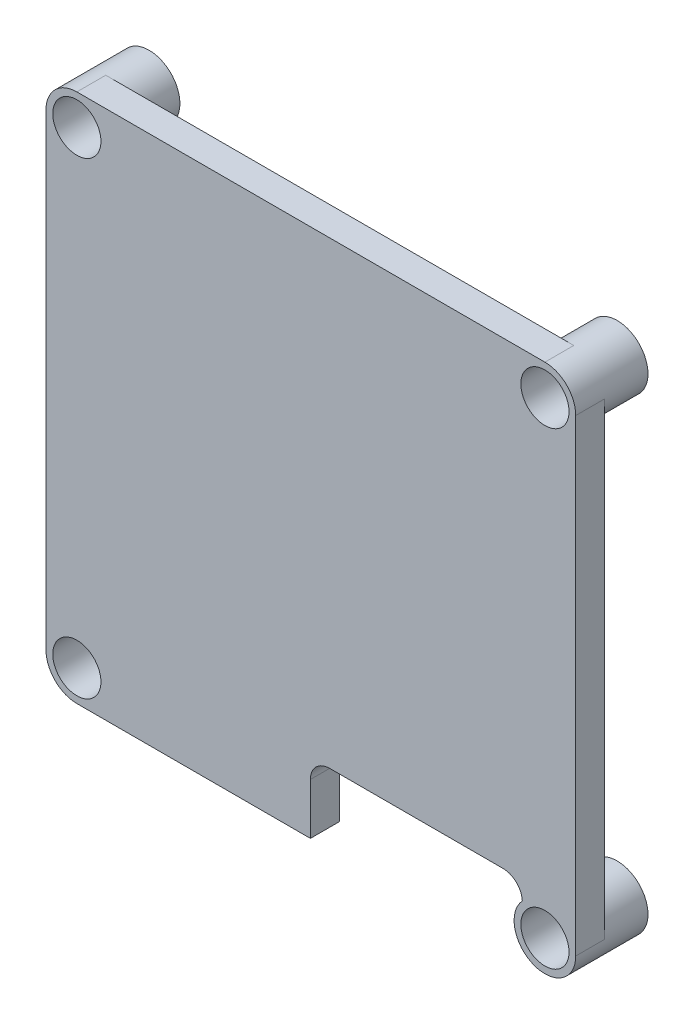
from build123d import *

# Parameters (mm, degrees)
SKETCH1_R             = 1.6
SKETCH1_R_2           = 1.25
BOSS_EXTRUDE1_DEPTH   = 2.25
BOSS_EXTRUDE1_2_DEPTH = 2.25
BOSS_EXTRUDE1_3_DEPTH = 2.25
BOSS_EXTRUDE1_4_DEPTH = 2.25
SKETCH2_R             = 1.25
BOSS_EXTRUDE2_DEPTH   = 1.5
FILLET1_R             = 1


with BuildPart() as part:
    # Sketch1 → Boss-Extrude1 (new body)
    with BuildSketch(Plane.XY):
        with Locations((-12.15, 12.15)):
            Circle(SKETCH1_R)
        with Locations((-12.15, 12.15)):
            Circle(SKETCH1_R_2, mode=Mode.SUBTRACT)
    extrude(amount=BOSS_EXTRUDE1_DEPTH)



with BuildPart() as body_2:
    # Sketch1 → Boss-Extrude1 2 (new body)
    with BuildSketch(Plane.XY):
        with Locations((12.15, 12.15)):
            Circle(SKETCH1_R)
        with Locations((12.15, 12.15)):
            Circle(SKETCH1_R_2, mode=Mode.SUBTRACT)
    extrude(amount=BOSS_EXTRUDE1_2_DEPTH)


with BuildPart() as body_3:
    # Sketch1 → Boss-Extrude1 3 (new body)
    with BuildSketch(Plane.XY):
        with Locations((12.15, -12.15)):
            Circle(SKETCH1_R)
        with Locations((12.15, -12.15)):
            Circle(SKETCH1_R_2, mode=Mode.SUBTRACT)
    extrude(amount=BOSS_EXTRUDE1_3_DEPTH)


with BuildPart() as body_4:
    # Sketch1 → Boss-Extrude1 4 (new body)
    with BuildSketch(Plane.XY):
        with Locations((-12.15, -12.15)):
            Circle(SKETCH1_R)
        with Locations((-12.15, -12.15)):
            Circle(SKETCH1_R_2, mode=Mode.SUBTRACT)
    extrude(amount=BOSS_EXTRUDE1_4_DEPTH)


with BuildPart() as part_1:
    add(part.part)

    add(body_2.part)  # Boss-Extrude2 merges body 2

    add(body_3.part)  # Boss-Extrude2 merges body 3

    add(body_4.part)  # Boss-Extrude2 merges body 4
    # Sketch2 → Boss-Extrude2 (add)
    with BuildSketch(Plane.XY.offset(2.25)):
        with BuildLine():
            Line((12.15, 13.75), (-12.15, 13.75))
            ThreePointArc((-12.15, 13.75), (-13.28137085, 13.28137085), (-13.75, 12.15))
            Line((-13.75, 12.15), (-13.75, -12.15))
            ThreePointArc((-13.75, -12.15), (-13.28137085, -13.28137085), (-12.15, -13.75))
            Line((-12.15, -13.75), (-0.025, -13.75))
            Line((-0.025, -13.75), (-0.025, -10.1))
            Line((-0.025, -10.1), (10.975, -10.1))
            Line((10.975, -10.1), (10.975, -11.064009669))
            ThreePointArc((10.975, -11.064009669), (11.566904811, -13.639966443), (13.75, -12.15))
            Line((13.75, -12.15), (13.75, 12.15))
            ThreePointArc((13.75, 12.15), (13.28137085, 13.28137085), (12.15, 13.75))
        make_face()
        with Locations((-12.15, 12.15)):
            Circle(SKETCH2_R, mode=Mode.SUBTRACT)
        with Locations((12.15, 12.15)):
            Circle(SKETCH2_R, mode=Mode.SUBTRACT)
        with Locations((-12.15, -12.15)):
            Circle(SKETCH2_R, mode=Mode.SUBTRACT)
        with Locations((12.15, -12.15)):
            Circle(SKETCH2_R, mode=Mode.SUBTRACT)
    extrude(amount=BOSS_EXTRUDE2_DEPTH)

    # Fillet1
    # the kernel refuses this fillet: 1 mm, written as the material it adds along each edge
    with BuildSketch(Plane(origin=(10.975, -10.1, 2.25), x_dir=(-1, 0, 0), z_dir=(0, 0, 1)), Plane(origin=(-0.025, -10.1, 2.25), x_dir=(0, -1, 0), z_dir=(0, 0, 1))) as fillet1_piece_1:
        with BuildLine():
            CenterArc((FILLET1_R, FILLET1_R), FILLET1_R, 180, 90)
            Line((0, FILLET1_R), (0, 0))
            Line((0, 0), (FILLET1_R, 0))
        make_face()
    extrude(amount=1.5)


solid = part_1.part
